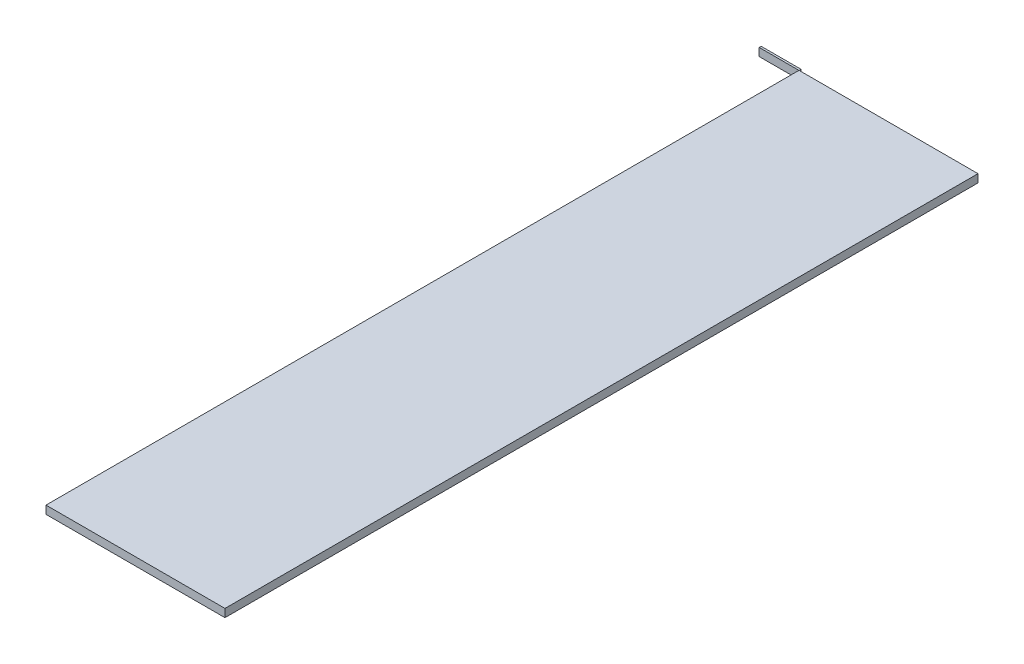
from build123d import *

# Parameters (mm, degrees)
SKETCH2_W           = 254
SKETCH2_H           = 12.7
BOSS_EXTRUDE1_DEPTH = 50.8
SCALE2_SCALE        = 0.06
ROTATE_ANGLE        = 90
SCALE5_SCALE        = 0.25
SCALE6_SCALE        = 0.25
SKETCH5_W           = 4.284328183
SKETCH5_H           = 18.027265667
BOSS_EXTRUDE4_DEPTH = 0.192532


with BuildPart() as part:
    # Sketch2 → Boss-Extrude1 (new body)
    with BuildSketch(Plane.XY):
        with Locations((79.130769231, 14.898076923)):
            Rectangle(SKETCH2_W, SKETCH2_H)
    extrude(amount=BOSS_EXTRUDE1_DEPTH)


with BuildPart() as part_1:
    # Scale2: scaled about (79.130769231, 14.898076923, 25.4)
    add(part.part.scale(SCALE2_SCALE).moved(Location((74.382923077, 14.004192308, 23.876))))


with BuildPart() as part_2:
    # rotate: moved
    add(part_1.part.rotate(Axis((0, 33.666927966, 26.550068274), (1, 0, 0)), ROTATE_ANGLE))


with BuildPart() as part_3:
    # Scale5: scaled about (79.130769231, 34.81699624, 7.781217231)
    add(part_2.part.scale(SCALE5_SCALE).moved(Location((59.348076923, 26.11274718, 5.835912923))))


with BuildPart() as part_4:
    # Move Body 4 x: moved
    add(part_3.part.moved(Location((-101.6, 0, 0))))


with BuildPart() as part_5:
    # Move Body 2 y: moved
    add(part_4.part.moved(Location((0, -55.88, 0))))


with BuildPart() as part_6:
    # Scale6: scaled about (-22.469230769, -21.06300376, 7.781217231)
    add(part_5.part.scale(SCALE6_SCALE).moved(Location((-16.851923077, -15.79725282, 5.835912923))))


with BuildPart() as part_7:
    # Move Body 2.1z: moved
    add(part_6.part.moved(Location((0, 0, -30.48))))


with BuildPart() as body_2:
    # Sketch5 → Boss-Extrude4 (new body)
    with BuildSketch(Plane(origin=(0, -21.15825376, 0), x_dir=(-1, 0, 0), z_dir=(0, -1, 0))):
        with Locations((19.850816677, 13.661337436)):
            Rectangle(SKETCH5_W, SKETCH5_H)
    extrude(amount=-BOSS_EXTRUDE4_DEPTH)


solid = Compound([part_7.part, body_2.part])
